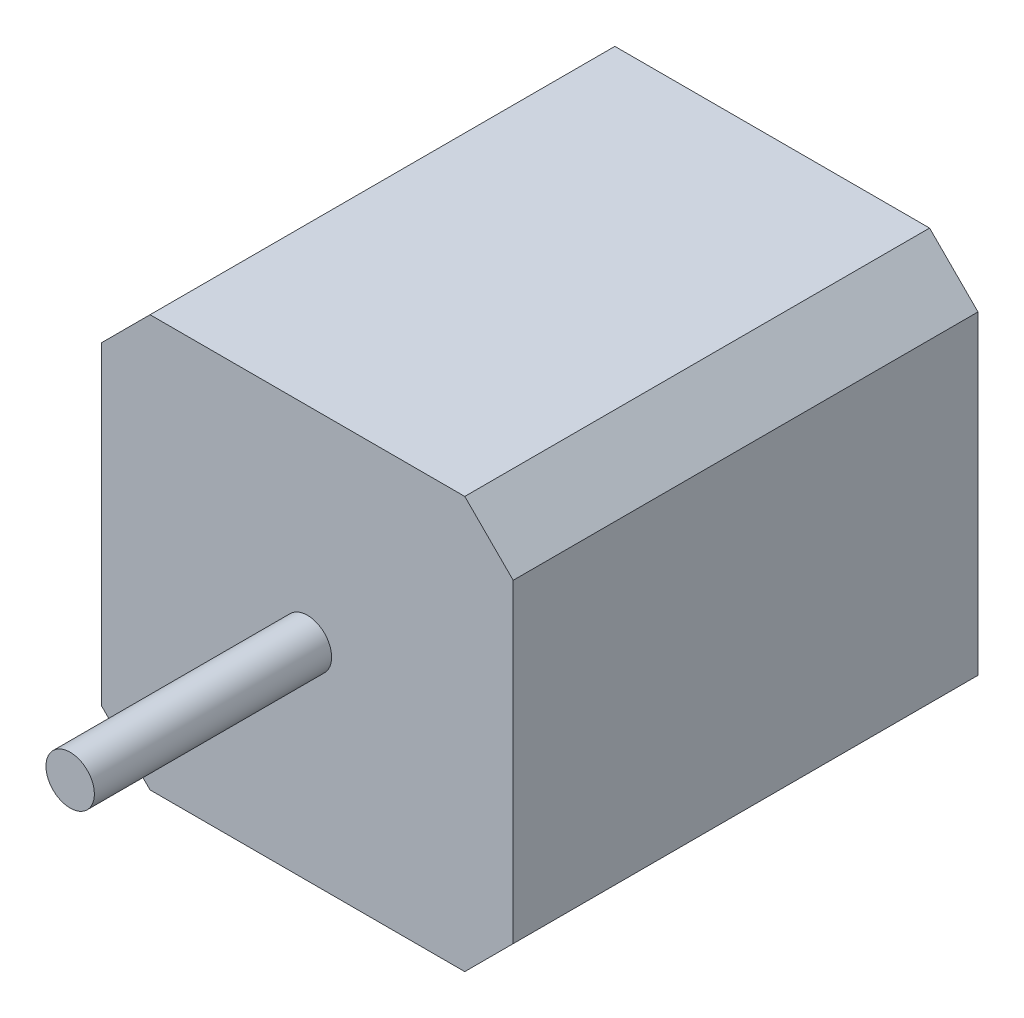
from build123d import *

# Parameters (mm, degrees)
SKETCH1_W           = 42.5
SKETCH1_H           = 42.5
BOSS_EXTRUDE1_DEPTH = 48
CHAMFER1_SIZE       = 5
SKETCH2_R           = 2.5
BOSS_EXTRUDE2_DEPTH = 24.5


with BuildPart() as part:
    # Sketch1 → Boss-Extrude1 (new body)
    with BuildSketch(Plane.XY):
        with Locations((-20.394847779, 6.347974521)):
            Rectangle(SKETCH1_W, SKETCH1_H)
    extrude(amount=BOSS_EXTRUDE1_DEPTH)

    # Chamfer1
    chamfer1_edges = [part.edges().sort_by_distance(p)[0] for p in [
        (0.855152221, 27.597974521, 24),
        (0.855152221, -14.902025479, 24),
        (-41.644847779, -14.902025479, 24),
        (-41.644847779, 27.597974521, 24),
    ]]
    chamfer(chamfer1_edges, length=CHAMFER1_SIZE)

    # Sketch2 → Boss-Extrude2 (add)
    with BuildSketch(Plane.XY.offset(48)):
        with Locations((-20.394847779, 6.347974521)):
            Circle(SKETCH2_R)
    extrude(amount=BOSS_EXTRUDE2_DEPTH)


solid = part.part
